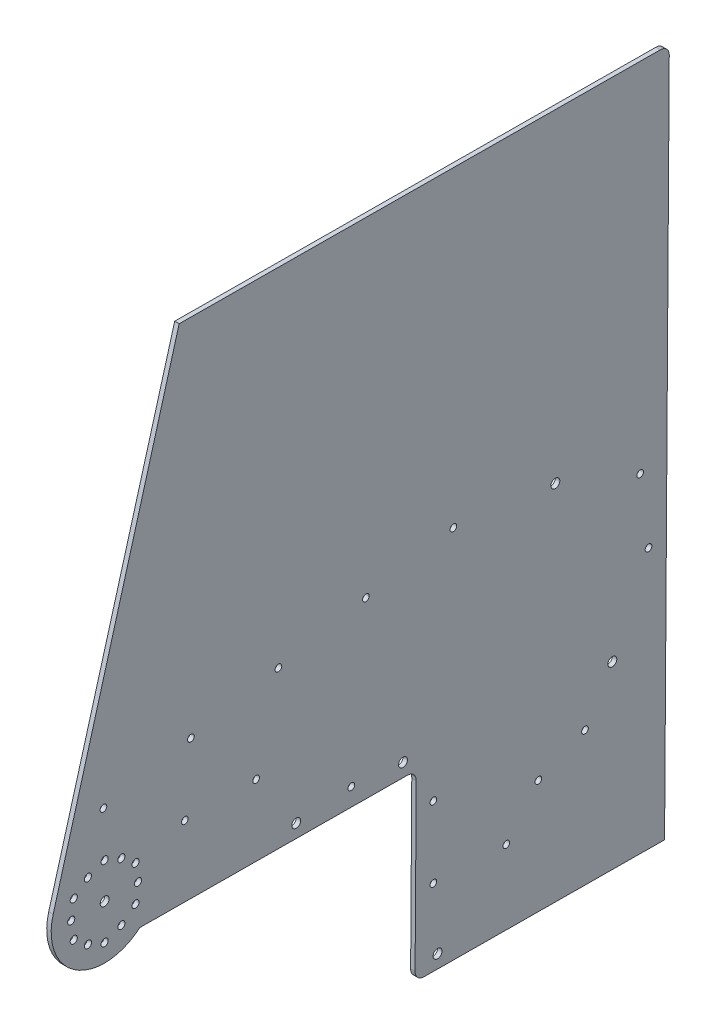
from build123d import *

# Parameters (mm, degrees)
SKETCH1_R           = 3.175
BOSS_EXTRUDE1_DEPTH = 3.175
SKETCH2_R           = 2.38125
CUT_EXTRUDE1_DEPTH  = 871.893802424
SKETCH5_R           = 2.5527
CUT_EXTRUDE2_DEPTH  = 871.893802424


with BuildPart() as part:
    # Sketch1 → Boss-Extrude1 (new body)
    with BuildSketch(Plane(origin=(2097.33945945, 0, 0), x_dir=(0, 0, -1), z_dir=(1, 0, 0))):
        with BuildLine():
            Line((813.354322932, 291.902453927), (470.462593133, 294.283973481))
            Line((470.462593133, 294.283973481), (380.69060226, -25.250155611))
            ThreePointArc((380.69060226, -25.250155611), (396.988966218, -67.7453513), (442.372216694, -64.304580962))
            Line((442.372216694, -64.304580962), (633.066836095, -65.629031002))
            ThreePointArc((633.066836095, -65.629031002), (637.543938621, -67.520043059), (639.372580729, -72.022980064))
            Line((639.372580729, -72.022980064), (638.556689771, -189.495146754))
            ThreePointArc((638.556689771, -189.495146754), (640.385331878, -193.998083759), (644.862434405, -195.889095816))
            Line((644.862434405, -195.889095816), (816.308299304, -197.079855594))
            Line((816.308299304, -197.079855594), (819.660067566, 285.508504864))
            ThreePointArc((819.660067566, 285.508504864), (817.831425459, 290.01144187), (813.354322932, 291.902453927))
        make_face()
        with Locations((553.895503221, -55.553924847)):
            Circle(SKETCH1_R, mode=Mode.SUBTRACT)
        with Locations((654.585392145, -186.431395895)):
            Circle(SKETCH1_R, mode=Mode.SUBTRACT)
        with Locations((629.958065992, -56.082209622)):
            Circle(SKETCH1_R, mode=Mode.SUBTRACT)
        with Locations((779.099930223, -68.570323835)):
            Circle(SKETCH1_R, mode=Mode.SUBTRACT)
        with Locations((738.492000758, 61.775645376)):
            Circle(SKETCH1_R, mode=Mode.SUBTRACT)
        with Locations((417.370503221, -35.55524491)):
            Circle(SKETCH1_R, mode=Mode.SUBTRACT)
    extrude(amount=BOSS_EXTRUDE1_DEPTH)

    # Sketch2 → Cut-Extrude1 (cut, through all)
    with BuildSketch(Plane(origin=(2100.51445945, 0, 0), x_dir=(0, 0, -1), z_dir=(1, 0, 0))):
        with Locations((759.618090186, -100.982485439)):
            Circle(SKETCH2_R)
        with Locations((541.187693092, 46.53204311)):
            Circle(SKETCH2_R)
        with Locations((478.851639869, 34.42970992)):
            Circle(SKETCH2_R)
        with Locations((416.515586647, 22.327376731)):
            Circle(SKETCH2_R)
        with Locations((525.320503221, -14.245042905)):
            Circle(SKETCH2_R)
        with Locations((798.886947172, 37.479390763)):
            Circle(SKETCH2_R)
        with Locations((665.859799537, 70.736709489)):
            Circle(SKETCH2_R)
        with Locations((603.523746314, 58.634376299)):
            Circle(SKETCH2_R)
        with Locations((703.559149884, -143.519538535)):
            Circle(SKETCH2_R)
        with Locations((726.384244699, -115.392244277)):
            Circle(SKETCH2_R)
        with Locations((804.898658391, -11.249556635)):
            Circle(SKETCH2_R)
        with Locations((474.520503221, -14.245042905)):
            Circle(SKETCH2_R)
        with Locations((651.589984927, -141.551336746)):
            Circle(SKETCH2_R)
        with Locations((651.589984927, -90.751336746)):
            Circle(SKETCH2_R)
        with Locations((593.128456503, -52.651336746)):
            Circle(SKETCH2_R)
    extrude(amount=-CUT_EXTRUDE1_DEPTH, mode=Mode.SUBTRACT)

    # Sketch5 → Cut-Extrude2 (cut, through all)
    with BuildSketch(Plane(origin=(2100.51445945, 0, 0), x_dir=(0, 0, -1), z_dir=(1, 0, 0))):
        with Locations((395.373457964, -48.255244909)):
            Circle(SKETCH5_R)
        with Locations((405.46425322, -56.177474835)):
            Circle(SKETCH5_R)
        with Locations((395.373457964, -22.855244907)):
            Circle(SKETCH5_R)
        with Locations((393.55800322, -35.555244908)):
            Circle(SKETCH5_R)
        with Locations((417.370503221, -10.155244906)):
            Circle(SKETCH5_R)
        with Locations((405.46425322, -14.93301498)):
            Circle(SKETCH5_R)
        with Locations((439.367548478, -22.855244907)):
            Circle(SKETCH5_R)
        with Locations((429.276753221, -14.93301498)):
            Circle(SKETCH5_R)
        with Locations((439.367548478, -48.255244909)):
            Circle(SKETCH5_R)
        with Locations((441.183003221, -35.555244908)):
            Circle(SKETCH5_R)
        with Locations((417.370503221, -60.955244909)):
            Circle(SKETCH5_R)
        with Locations((429.276753221, -56.177474835)):
            Circle(SKETCH5_R)
    extrude(amount=-CUT_EXTRUDE2_DEPTH, mode=Mode.SUBTRACT)


solid = part.part
